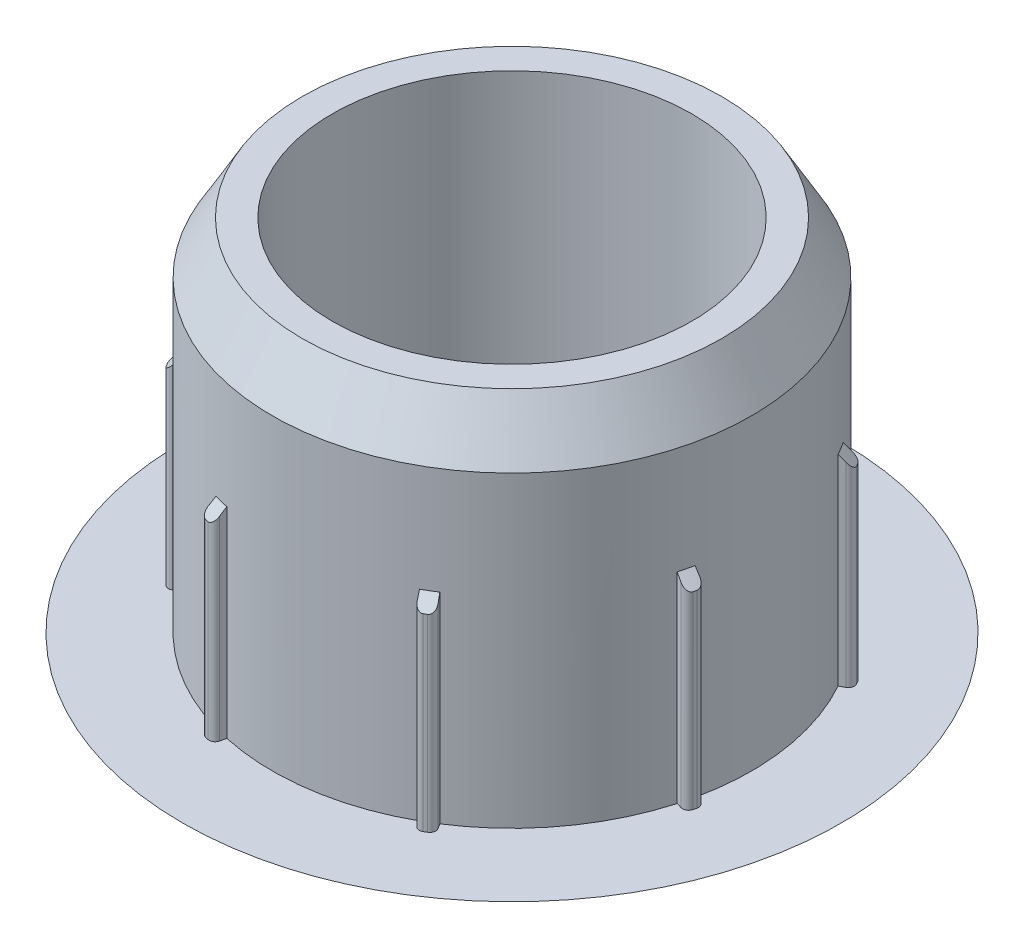
from build123d import *

# Parameters (mm, degrees)
CHANFREIN2_SIZE              = 1
CHANFREIN2_SIZE_2            = 1.732050808
CHANFREIN3_SIZE              = 0.5
CHANFREIN3_SIZE2             = 0.866025404
ENROULEMENT2_SECTION_W       = 0.2
ENROULEMENT2_SECTION_H       = 3.3494767
ENROULEMENT2_ANGLE           = 3.543505781
R_P_TITION_CIRCULAIRE3_COUNT = 8
CHANFREIN4_SIZE              = 0.2
CONG_1_R                     = 0.1


# Some blends are built 0.0001 mm under size
with BuildPart() as part:
    # Esquisse1 → Révolution1 (revolve)
    with BuildSketch(Plane.XY, mode=Mode.PRIVATE) as r_volution1_sk:
        Polygon((-5.844561756, 3.794871795), (-5.844561756, -2.205128205), (-7.344561756, -2.205128205), (-7.344561756, -3.205128205), (-1.844561756, -3.205128205), (-1.844561756, -2.205128205), (-4.844561756, -2.205128205), (-4.844561756, 3.794871795), align=None)
    revolve(r_volution1_sk.sketch.rotate(Axis((-1.844561756, -3.205128205, 0), (0, 1, 0)), 270), axis=Axis((-1.844561756, -3.205128205, 0), (0, 1, 0)))

    # Chanfrein2
    # the kernel refuses this chamfer: 1.732050808, 1 mm, written as the material it takes off along each edge
    with BuildSketch(Plane(origin=(-1.844561756, -3.205128205, 0), x_dir=(0, 0, -1), z_dir=(1, 0, 0))) as chanfrein2_piece_1:
        Polygon((5.5, CHANFREIN2_SIZE), (5.5 - CHANFREIN2_SIZE_2, 0), (5.5, 0), align=None)
    revolve(axis=Axis((-1.844561756, -3.205128205, 0), (0, 1, 0)), mode=Mode.SUBTRACT)

    # Chanfrein3
    chanfrein3_edges = [part.edges().sort_by_distance(p)[0] for p in [
        (-1.844561756, 3.794871795, 4),
    ]]
    chanfrein3_side = [part.faces().sort_by_distance(p)[0] for p in [
        (-1.844561756, 3.794871795, 3.113137085),
    ]]
    chamfer(chanfrein3_edges, length=CHANFREIN3_SIZE, length2=CHANFREIN3_SIZE2, reference=chanfrein3_side[0])

    # Enroulement2 section (on wrap section) → Enroulement2 (revolve)
    with BuildSketch(Plane(origin=(-1.844561756, 3.794871795, 0), x_dir=(-0.8414709848078965, 0, 0.5403023058681398), z_dir=(0.5403023058681398, 0, 0.8414709848078965))):
        with Locations((4.1, 4.32526165)):
            Rectangle(ENROULEMENT2_SECTION_W, ENROULEMENT2_SECTION_H)
    enroulement2 = revolve(axis=Axis((-1.844561756, 3.794871795, 0), (0, -1, 0)), revolution_arc=ENROULEMENT2_ANGLE)

    # Répétition circulaire3: Enroulement2 ×8 about axis
    r_p_tition_circulaire3_axis = Axis((-1.844561756, 0, 0), (0, 1, 0))
    for i in range(1, R_P_TITION_CIRCULAIRE3_COUNT):
        add(enroulement2.rotate(r_p_tition_circulaire3_axis, i * 360 / R_P_TITION_CIRCULAIRE3_COUNT))

    # Chanfrein4
    chanfrein4_edges = [part.edges().sort_by_distance(p)[0] for p in [
        (-2.865436347, 1.144348495, 4.074041614),
        (0.31435335, 1.144348495, 3.602649798),
        (2.229479857, 1.144348495, 1.020874591),
        (1.758088041, 1.144348495, -2.158915106),
        (-0.823687166, 1.144348495, -4.074041614),
        (-4.003476862, 1.144348495, -3.602649798),
        (-5.91860337, 1.144348495, -1.020874591),
        (-5.447211554, 1.144348495, 2.158915106),
    ]]
    chamfer(chanfrein4_edges, length=CHANFREIN4_SIZE - 0.0001)  # a hair under: the kernel refuses the full size

    # Congé1
    cong_1_edges = [part.edges().sort_by_distance(p)[0] for p in [
        (-2.7389871, -0.630339855, 4.103657308),
        (-2.990909484, -0.630339855, 4.04053052),
        (0.201934522, -0.630339855, 3.667676783),
        (2.195968764, -0.630339855, 1.146347728),
        (1.823115026, -0.630339855, -2.046496279),
        (-0.698214029, -0.630339855, -4.04053052),
        (-3.891058035, -0.630339855, -3.667676783),
        (-5.885092277, -0.630339855, -1.146347728),
        (-5.512238539, -0.630339855, 2.046496279),
        (-5.378739893, -0.630339855, 2.269269685),
        (-5.948219065, -0.630339855, -0.894425344),
        (-4.113831441, -0.630339855, -3.534178136),
        (-0.950136413, -0.630339855, -4.103657308),
        (1.68961638, -0.630339855, -2.269269685),
        (2.259095552, -0.630339855, 0.894425344),
        (0.424707928, -0.630339855, 3.534178136),
    ]]
    fillet(cong_1_edges, radius=CONG_1_R)


solid = part.part
